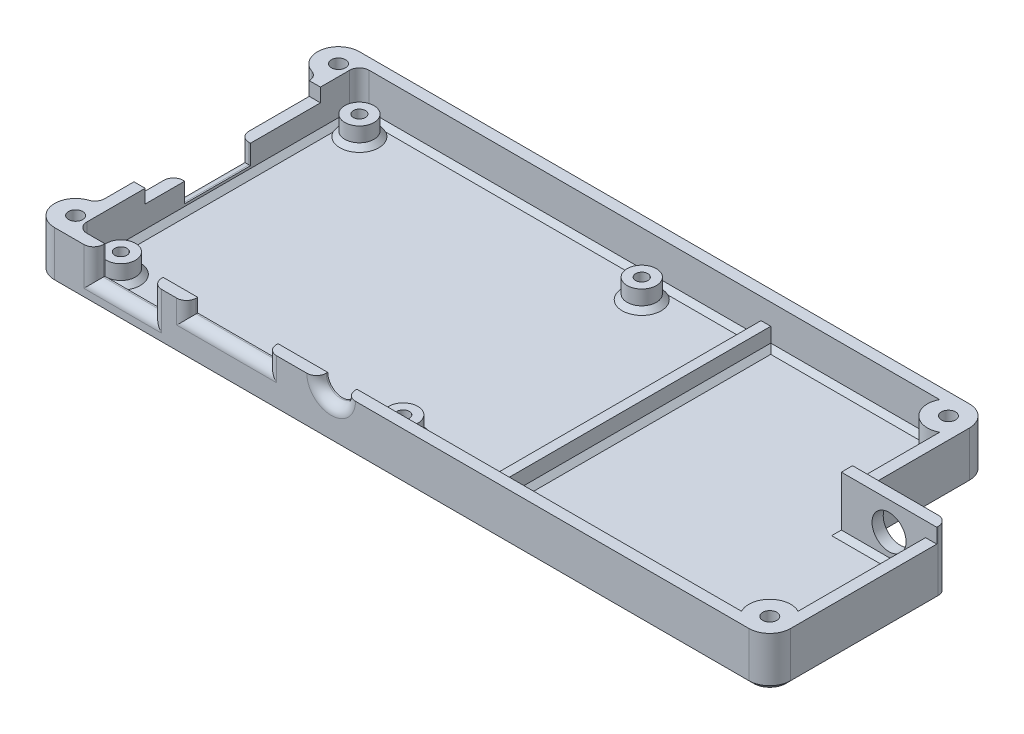
from build123d import *

# Parameters (mm, degrees)
BOSS_EXTRUDE1_DEPTH            = 10.3
BOSS_EXTRUDE2_DEPTH            = 2
SKETCH6_R                      = 3
BOSS_EXTRUDE3_DEPTH            = 4
F_2_5_2_5_DIAMETER_HOLE1_D     = 2.5
F_2_5_2_5_DIAMETER_HOLE1_DEPTH = 8
F_2_5_2_5_DIAMETER_HOLE1_TIP   = 0.751075774
SKETCH10_W                     = 2
SKETCH10_H                     = 58
BOSS_EXTRUDE4_DEPTH            = 4
CUT_EXTRUDE1_REACH             = 100.128
SKETCH11_R                     = 3
SKETCH11_W                     = 12
SKETCH11_H                     = 5.8
SKETCH11_W_2                   = 16.5
SKETCH11_H_2                   = 2.8
CUT_EXTRUDE2_REACH             = 153.227
SKETCH12_W                     = 13.5
SKETCH12_H                     = 6.8
SKETCH12_W_2                   = 36
SKETCH12_H_2                   = 2.8
FILLET6_R                      = 2
FILLET8_R                      = 2
CHAMFER1_SIZE                  = 1
FILLET9_R                      = 2
SKETCH14_W                     = 19.6
SKETCH14_H                     = 2.3
BOSS_EXTRUDE5_DEPTH            = 3
CUT_EXTRUDE3_REACH             = 86.384
SKETCH13_R                     = 3.5
BOSS_EXTRUDE6_DEPTH            = 10.3
F_2_9_2_9_DIAMETER_HOLE2_D     = 2.9
F_2_9_2_9_DIAMETER_HOLE1_D     = 2.9
BOSS_EXTRUDE7_REACH            = 89.052
SKETCH24_R                     = 4.3
F_2_9_2_9_DIAMETER_HOLE3_D     = 2.9
F_2_9_2_9_DIAMETER_HOLE4_D     = 2.9
FILLET10_R                     = 4.3
FILLET16_R                     = 4.3
FILLET17_R                     = 2
FILLET18_R                     = 2
CHAMFER3_SIZE                  = 1
FILLET19_R                     = 2


# Some blends are built 0.0001 mm under size
with BuildPart() as part:
    # Sketch3 → Boss-Extrude1 (new body)
    with BuildSketch(Plane(origin=(0, 0, 0), x_dir=(1, 0, 0), z_dir=(0, 1, 0))):
        Polygon((54.738233838, 8.405993834), (72.038233838, 8.405993834), (72.038233838, -28.194006166), (54.738233838, -28.194006166), (-74.861766162, -28.194006166), (-74.861766162, 34.405993834), (54.738233838, 34.405993834), align=None)
        Polygon((57.038233838, -25.894006166), (69.738233838, -25.894006166), (69.738233838, 6.105993834), (52.438233838, 6.105993834), (52.438233838, 32.105993834), (-72.561766162, 32.105993834), (-72.561766162, -25.894006166), (52.438233838, -25.894006166), align=None, mode=Mode.SUBTRACT)
    extrude(amount=BOSS_EXTRUDE1_DEPTH)

    # Sketch5 → Boss-Extrude2 (add)
    with BuildSketch(Plane(origin=(0, 0, 0), x_dir=(1, 0, 0), z_dir=(0, 1, 0))):
        Polygon((-72.561766162, 32.105993834), (52.438233838, 32.105993834), (52.438233838, 6.105993834), (69.738233838, 6.105993834), (69.738233838, -25.894006166), (50.438233838, -25.894006166), (-72.561766162, -25.894006166), align=None)
    extrude(amount=BOSS_EXTRUDE2_DEPTH)

    # Sketch6 → Boss-Extrude3 (add)
    with BuildSketch(Plane(origin=(0, 2, 0), x_dir=(1, 0, 0), z_dir=(0, 1, 0))):
        with Locations(Location((-68.061766162, 27.605993834, 0), (0, 0, 270))):
            Circle(SKETCH6_R)
        with Locations(Location((-68.061766162, -21.394006166, 0), (0, 0, 270))):
            Circle(SKETCH6_R)
        with Locations(Location((-10.061766162, -21.394006166, 0), (0, 0, 270))):
            Circle(SKETCH6_R)
        with Locations(Location((-10.061766162, 27.605993834, 0), (0, 0, 270))):
            Circle(SKETCH6_R)
    extrude(amount=BOSS_EXTRUDE3_DEPTH)

    # Ø2.5 (2.5) Diameter Hole1
    with Locations(Plane(origin=(0, 6, 0), x_dir=(1, 0, 0), z_dir=(0, 1, 0))):
        with Locations((-68.061766162, 27.605993834), (-10.061766162, 27.605993834), (-10.061766162, -21.394006166), (-68.061766162, -21.394006166)):
            Hole(F_2_5_2_5_DIAMETER_HOLE1_D / 2, depth=F_2_5_2_5_DIAMETER_HOLE1_DEPTH)
            with Locations((0, 0, -(F_2_5_2_5_DIAMETER_HOLE1_DEPTH + F_2_5_2_5_DIAMETER_HOLE1_TIP / 2))):  # 118° drill point
                Cone(0, F_2_5_2_5_DIAMETER_HOLE1_D / 2, F_2_5_2_5_DIAMETER_HOLE1_TIP, mode=Mode.SUBTRACT)

    # Sketch10 → Boss-Extrude4 (add)
    with BuildSketch(Plane(origin=(0, 2, 0), x_dir=(1, 0, 0), z_dir=(0, 1, 0))):
        with Locations((10.938233838, 3.105993834)):
            Rectangle(SKETCH10_W, SKETCH10_H)
    extrude(amount=BOSS_EXTRUDE4_DEPTH)

    # Sketch11 → Cut-Extrude1 (cut, up to next)
    with BuildSketch(Plane.XY.offset(28.194006166), mode=Mode.PRIVATE) as cut_extrude1_sk1:
        with Locations((-18.061766162, 10.3)):
            Circle(SKETCH11_R)
    cut_extrude1_tool1 = extrude(cut_extrude1_sk1.sketch, amount=-CUT_EXTRUDE1_REACH, mode=Mode.PRIVATE) & part.part
    # Sketch11 → Cut-Extrude1 (cut, up to next)
    with BuildSketch(Plane.XY.offset(28.194006166), mode=Mode.PRIVATE) as cut_extrude1_sk2:
        with Locations((-60.861766162, 7.4)):
            Rectangle(SKETCH11_W, SKETCH11_H)
    cut_extrude1_tool2 = extrude(cut_extrude1_sk2.sketch, amount=-CUT_EXTRUDE1_REACH, mode=Mode.PRIVATE) & part.part
    # Sketch11 → Cut-Extrude1 (cut, up to next)
    with BuildSketch(Plane.XY.offset(28.194006166), mode=Mode.PRIVATE) as cut_extrude1_sk3:
        with Locations((-39.527982648, 8.9)):
            Rectangle(SKETCH11_W_2, SKETCH11_H_2)
    cut_extrude1_tool3 = extrude(cut_extrude1_sk3.sketch, amount=-CUT_EXTRUDE1_REACH, mode=Mode.PRIVATE) & part.part
    add(cut_extrude1_tool1.solids().sort_by_distance((-18.061766, 10.3, 28.194006))[0], mode=Mode.SUBTRACT)
    add(cut_extrude1_tool2.solids().sort_by_distance((-60.861766, 7.4, 28.194006))[0], mode=Mode.SUBTRACT)
    add(cut_extrude1_tool3.solids().sort_by_distance((-39.527983, 8.9, 28.194006))[0], mode=Mode.SUBTRACT)

    # Sketch12 → Cut-Extrude2 (cut, up to next)
    with BuildSketch(Plane.ZY.offset(74.861766162), mode=Mode.PRIVATE) as cut_extrude2_sk1:
        with Locations((-2.982922372, 6.9)):
            Rectangle(SKETCH12_W, SKETCH12_H)
    cut_extrude2_tool1 = extrude(cut_extrude2_sk1.sketch, amount=-CUT_EXTRUDE2_REACH, mode=Mode.PRIVATE) & part.part
    # Sketch12 → Cut-Extrude2 (cut, up to next)
    with BuildSketch(Plane.ZY.offset(74.861766162), mode=Mode.PRIVATE) as cut_extrude2_sk2:
        with Locations((-6.105993834, 8.9)):
            Rectangle(SKETCH12_W_2, SKETCH12_H_2)
    cut_extrude2_tool2 = extrude(cut_extrude2_sk2.sketch, amount=-CUT_EXTRUDE2_REACH, mode=Mode.PRIVATE) & part.part
    add(cut_extrude2_tool1.solids().sort_by_distance((-74.861766, 6.9, -2.982922))[0], mode=Mode.SUBTRACT)
    add(cut_extrude2_tool2.solids().sort_by_distance((-74.861766, 8.9, -6.105994))[0], mode=Mode.SUBTRACT)

    # Fillet6
    fillet6_edges = [part.edges().sort_by_distance(p)[0] for p in [
        (52.438233838, 6.15, -32.105993834),
    ]]
    fillet(fillet6_edges, radius=FILLET6_R)

    # Fillet8
    fillet8_edges = [part.edges().sort_by_distance(p)[0] for p in [
        (-72.561766162, 6.15, -32.105993834),
        (-72.561766162, 6.15, 25.894006166),
    ]]
    fillet(fillet8_edges, radius=FILLET8_R)

    # Chamfer1
    chamfer1_edges = [part.edges().sort_by_distance(p)[0] for p in [
        (-68.061766162, 2, -30.605993834),
        (-68.061766162, 2, 18.394006166),
        (-10.061766162, 2, 18.394006166),
        (-10.061766162, 2, -30.605993834),
    ]]
    chamfer(chamfer1_edges, length=CHAMFER1_SIZE)

    # Chamfer2
    # the kernel refuses this chamfer: 1 mm, written as the material it adds along each edge
    with BuildSketch(Plane(origin=(69.738233838, 2, 25.894006166), x_dir=(0, 0.9996219169112968, 0.027495876610585623), z_dir=(-1, 0, 0))) as chamfer2_piece_1:
        with BuildLine():
            Line((1.028673195, 0), (-0.056547155, 1.027117794))
            Line((-0.056547155, 1.027117794), (-0.076539593, 1.026567876))
            ThreePointArc((-0.076539593, 1.026567876), (-0.034129227, 0.51339783), (-0.019992438, -0.000549918))
            Line((-0.019992438, -0.000549918), (0.000549918, -0.019992438))
            ThreePointArc((0.000549918, -0.019992438), (0.514497665, -0.00585565), (1.029223113, -0.019992438))
            Line((1.029223113, -0.019992438), (1.028673195, 0))
        make_face()
    extrude(amount=57.8)
    with BuildSketch(Plane(origin=(-70.561766162, 2, -32.105993834), x_dir=(0, -0.027495876610586296, 0.9996219169112968), z_dir=(1, 0, 0)), Plane(origin=(9.938233838, 2, 25.894006166), x_dir=(0, -0.027495876610586726, -0.9996219169112968), z_dir=(-1, 0, 0))) as chamfer2_piece_2:
        with BuildLine():
            Line((1.028673195, 0), (-0.056547155, -1.027117794))
            Line((-0.056547155, -1.027117794), (-0.076539593, -1.026567876))
            ThreePointArc((-0.076539593, -1.026567876), (-0.034129227, -0.51339783), (-0.019992438, 0.000549918))
            Line((-0.019992438, 0.000549918), (0.000549918, 0.019992438))
            ThreePointArc((0.000549918, 0.019992438), (0.514497665, 0.00585565), (1.029223113, 0.019992438))
            Line((1.029223113, 0.019992438), (1.028673195, 0))
        make_face()
    extrude(amount=80.5)
    with BuildSketch(Plane(origin=(9.938233838, 2, 25.894006166), x_dir=(-0.9996219169112968, -0.027495876610586247, 0), z_dir=(0, 0, -1))) as chamfer2_piece_3:
        with BuildLine():
            Line((1.028673195, 0), (-0.056547155, 1.027117794))
            Line((-0.056547155, 1.027117794), (-0.076539593, 1.026567876))
            ThreePointArc((-0.076539593, 1.026567876), (-0.034129227, 0.51339783), (-0.019992438, -0.000549918))
            Line((-0.019992438, -0.000549918), (0.000549918, -0.019992438))
            ThreePointArc((0.000549918, -0.019992438), (0.514497665, -0.00585565), (1.029223113, -0.019992438))
            Line((1.029223113, -0.019992438), (1.028673195, 0))
        make_face()
    extrude(amount=58)
    with BuildSketch(Plane(origin=(11.938233838, 2, -32.105993834), x_dir=(-0.027495876610585623, 0.9996219169112968, 0), z_dir=(0, 0, 1))) as chamfer2_piece_4:
        with BuildLine():
            Line((1.028673195, 0), (-0.056547155, -1.027117794))
            Line((-0.056547155, -1.027117794), (-0.076539593, -1.026567876))
            ThreePointArc((-0.076539593, -1.026567876), (-0.034129227, -0.51339783), (-0.019992438, 0.000549918))
            Line((-0.019992438, 0.000549918), (0.000549918, 0.019992438))
            ThreePointArc((0.000549918, 0.019992438), (0.514497665, 0.00585565), (1.029223113, 0.019992438))
            Line((1.029223113, 0.019992438), (1.028673195, 0))
        make_face()
    extrude(amount=58)
    with BuildSketch(Plane(origin=(11.938233838, 2, -32.105993834), x_dir=(0, 0.9996219169112968, -0.027495876610589075), z_dir=(1, 0, 0))) as chamfer2_piece_5:
        with BuildLine():
            Line((1.028673195, 0), (-0.056547155, 1.027117794))
            Line((-0.056547155, 1.027117794), (-0.076539593, 1.026567876))
            ThreePointArc((-0.076539593, 1.026567876), (-0.034129227, 0.51339783), (-0.019992438, -0.000549918))
            Line((-0.019992438, -0.000549918), (0.000549918, -0.019992438))
            ThreePointArc((0.000549918, -0.019992438), (0.514497665, -0.00585565), (1.029223113, -0.019992438))
            Line((1.029223113, -0.019992438), (1.028673195, 0))
        make_face()
    extrude(amount=38.5)
    with BuildSketch(Plane(origin=(50.438233838, 2, -30.105993834), x_dir=(0, 0, -1), z_dir=(-1, 0, 0))) as chamfer2_piece_6:
        with BuildLine():
            Line((0.971715729, 0.028284271), (2.028284271, -1.028284271))
            Line((2.028284271, -1.028284271), (2.048284271, -1.028284271))
            ThreePointArc((2.048284271, -1.028284271), (2.02, -0.514142136), (2.02, 0))
            Line((2.02, 0), (2, 0.02))
            ThreePointArc((2, 0.02), (1.485857864, 0.02), (0.971715729, 0.048284271))
            Line((0.971715729, 0.048284271), (0.971715729, 0.028284271))
        make_face()
    revolve(axis=Axis((50.438233838, 2, -30.105993834), (0, -1, 0)), revolution_arc=90)
    with BuildSketch(Plane(origin=(-72.561766162, 2, 23.894006166), x_dir=(0.9996219169112968, -0.027495876610586605, 0), z_dir=(0, 0, -1))) as chamfer2_piece_7:
        with BuildLine():
            Line((1.028673195, 0), (-0.056547155, -1.027117794))
            Line((-0.056547155, -1.027117794), (-0.076539593, -1.026567876))
            ThreePointArc((-0.076539593, -1.026567876), (-0.034129227, -0.51339783), (-0.019992438, 0.000549918))
            Line((-0.019992438, 0.000549918), (0.000549918, 0.019992438))
            ThreePointArc((0.000549918, 0.019992438), (0.514497665, 0.00585565), (1.029223113, 0.019992438))
            Line((1.029223113, 0.019992438), (1.028673195, 0))
        make_face()
    extrude(amount=54)
    with BuildSketch(Plane(origin=(-70.561766162, 2, -30.105993834), x_dir=(0, 0, -1), z_dir=(1, 0, 0))) as chamfer2_piece_8:
        with BuildLine():
            Line((0.971715729, -0.028284271), (2.028284271, 1.028284271))
            Line((2.028284271, 1.028284271), (2.048284271, 1.028284271))
            ThreePointArc((2.048284271, 1.028284271), (2.02, 0.514142136), (2.02, 0))
            Line((2.02, 0), (2, -0.02))
            ThreePointArc((2, -0.02), (1.485857864, -0.02), (0.971715729, -0.048284271))
            Line((0.971715729, -0.048284271), (0.971715729, -0.028284271))
        make_face()
    revolve(axis=Axis((-70.561766162, 2, -30.105993834), (0, 1, 0)), revolution_arc=90)
    with BuildSketch(Plane(origin=(-70.561766162, 2, 23.894006166), x_dir=(-1, 0, 0), z_dir=(0, 0, -1))) as chamfer2_piece_9:
        with BuildLine():
            Line((0.971715729, -0.028284271), (2.028284271, 1.028284271))
            Line((2.028284271, 1.028284271), (2.048284271, 1.028284271))
            ThreePointArc((2.048284271, 1.028284271), (2.02, 0.514142136), (2.02, 0))
            Line((2.02, 0), (2, -0.02))
            ThreePointArc((2, -0.02), (1.485857864, -0.02), (0.971715729, -0.048284271))
            Line((0.971715729, -0.048284271), (0.971715729, -0.028284271))
        make_face()
    revolve(axis=Axis((-70.561766162, 2, 23.894006166), (0, 1, 0)), revolution_arc=90)
    with BuildSketch(Plane(origin=(69.738233838, 2, -6.105993834), x_dir=(-0.9996219169112968, -0.02749587661058639, 0), z_dir=(0, 0, 1))) as chamfer2_piece_10:
        with BuildLine():
            Line((1.028673195, 0), (-0.056547155, -1.027117794))
            Line((-0.056547155, -1.027117794), (-0.076539593, -1.026567876))
            ThreePointArc((-0.076539593, -1.026567876), (-0.034129227, -0.51339783), (-0.019992438, 0.000549918))
            Line((-0.019992438, 0.000549918), (0.000549918, 0.019992438))
            ThreePointArc((0.000549918, 0.019992438), (0.514497665, 0.00585565), (1.029223113, 0.019992438))
            Line((1.029223113, 0.019992438), (1.028673195, 0))
        make_face()
    extrude(amount=32)
    with BuildSketch(Plane(origin=(52.438233838, 2, -6.105993834), x_dir=(0, -0.02749587661058627, 0.9996219169112968), z_dir=(1, 0, 0))) as chamfer2_piece_11:
        with BuildLine():
            Line((1.028673195, 0), (-0.056547155, -1.027117794))
            Line((-0.056547155, -1.027117794), (-0.076539593, -1.026567876))
            ThreePointArc((-0.076539593, -1.026567876), (-0.034129227, -0.51339783), (-0.019992438, 0.000549918))
            Line((-0.019992438, 0.000549918), (0.000549918, 0.019992438))
            ThreePointArc((0.000549918, 0.019992438), (0.514497665, 0.00585565), (1.029223113, 0.019992438))
            Line((1.029223113, 0.019992438), (1.028673195, 0))
        make_face()
    extrude(amount=17.3)
    with BuildSketch(Plane(origin=(52.438233838, 2, -30.105993834), x_dir=(-0.9996219169112968, -0.0274958766105862, 0), z_dir=(0, 0, 1))) as chamfer2_piece_12:
        with BuildLine():
            Line((1.028673195, 0), (-0.056547155, -1.027117794))
            Line((-0.056547155, -1.027117794), (-0.076539593, -1.026567876))
            ThreePointArc((-0.076539593, -1.026567876), (-0.034129227, -0.51339783), (-0.019992438, 0.000549918))
            Line((-0.019992438, 0.000549918), (0.000549918, 0.019992438))
            ThreePointArc((0.000549918, 0.019992438), (0.514497665, 0.00585565), (1.029223113, 0.019992438))
            Line((1.029223113, 0.019992438), (1.028673195, 0))
        make_face()
    extrude(amount=24)
    with BuildSketch(Plane(origin=(72.309916826, 2, 25.894006166), x_dir=(0, 0.9996219169112968, 0.027495876610585623), z_dir=(-1, 0, 0))) as chamfer2_piece_13a_section:
        with BuildLine():
            Line((1.028673195, 0), (-0.056547155, 1.027117794))
            Line((-0.056547155, 1.027117794), (-0.076539593, 1.026567876))
            ThreePointArc((-0.076539593, 1.026567876), (-0.034129227, 0.51339783), (-0.019992438, -0.000549918))
            Line((-0.019992438, -0.000549918), (0.000549918, -0.019992438))
            ThreePointArc((0.000549918, -0.019992438), (0.514497665, -0.00585565), (1.029223113, -0.019992438))
            Line((1.029223113, -0.019992438), (1.028673195, 0))
        make_face()
    chamfer2_piece_13a = extrude(amount=60.371682988, mode=Mode.PRIVATE)
    chamfer2_piece_13a = split(chamfer2_piece_13a, bisect_by=Plane(origin=(69.738233838, 2.329793627, 25.564212539), z_dir=(1, 0, 0)), keep=Keep.TOP, mode=Mode.PRIVATE)
    with BuildSketch(Plane(origin=(69.738233838, 2, -6.105993834), x_dir=(-0.9996219169112968, -0.02749587661058639, 0), z_dir=(0, 0, 1))) as chamfer2_piece_13b_section:
        with BuildLine():
            Line((1.028673195, 0), (-0.056547155, -1.027117794))
            Line((-0.056547155, -1.027117794), (-0.076539593, -1.026567876))
            ThreePointArc((-0.076539593, -1.026567876), (-0.034129227, -0.51339783), (-0.019992438, 0.000549918))
            Line((-0.019992438, 0.000549918), (0.000549918, 0.019992438))
            ThreePointArc((0.000549918, 0.019992438), (0.514497665, 0.00585565), (1.029223113, 0.019992438))
            Line((1.029223113, 0.019992438), (1.028673195, 0))
        make_face()
    chamfer2_piece_13b = extrude(amount=34.571682988, mode=Mode.PRIVATE)
    chamfer2_piece_13b = split(chamfer2_piece_13b, bisect_by=Plane(origin=(69.408440211, 2.329793627, 25.894006166), z_dir=(0, 0, 1)), keep=Keep.TOP, mode=Mode.PRIVATE)
    chamfer2_piece_13 = chamfer2_piece_13a & chamfer2_piece_13b
    add(chamfer2_piece_13)
    with BuildSketch(Plane(origin=(69.738233838, 2, 25.894006166), x_dir=(0, 0.9996219169112968, 0.027495876610585623), z_dir=(-1, 0, 0))) as chamfer2_piece_14a_section:
        with BuildLine():
            Line((1.028673195, 0), (-0.056547155, 1.027117794))
            Line((-0.056547155, 1.027117794), (-0.076539593, 1.026567876))
            ThreePointArc((-0.076539593, 1.026567876), (-0.034129227, 0.51339783), (-0.019992438, -0.000549918))
            Line((-0.019992438, -0.000549918), (0.000549918, -0.019992438))
            ThreePointArc((0.000549918, -0.019992438), (0.514497665, -0.00585565), (1.029223113, -0.019992438))
            Line((1.029223113, -0.019992438), (1.028673195, 0))
        make_face()
    chamfer2_piece_14a = extrude(amount=60.371682988, mode=Mode.PRIVATE)
    chamfer2_piece_14a = split(chamfer2_piece_14a, bisect_by=Plane(origin=(11.938233838, 2.329793627, 25.564212539), z_dir=(-1, 0, 0)), keep=Keep.TOP, mode=Mode.PRIVATE)
    with BuildSketch(Plane(origin=(11.938233838, 2, -32.105993834), x_dir=(-0.027495876610585623, 0.9996219169112968, 0), z_dir=(0, 0, 1))) as chamfer2_piece_14b_section:
        with BuildLine():
            Line((1.028673195, 0), (-0.056547155, -1.027117794))
            Line((-0.056547155, -1.027117794), (-0.076539593, -1.026567876))
            ThreePointArc((-0.076539593, -1.026567876), (-0.034129227, -0.51339783), (-0.019992438, 0.000549918))
            Line((-0.019992438, 0.000549918), (0.000549918, 0.019992438))
            ThreePointArc((0.000549918, 0.019992438), (0.514497665, 0.00585565), (1.029223113, 0.019992438))
            Line((1.029223113, 0.019992438), (1.028673195, 0))
        make_face()
    chamfer2_piece_14b = extrude(amount=60.571682988, mode=Mode.PRIVATE)
    chamfer2_piece_14b = split(chamfer2_piece_14b, bisect_by=Plane(origin=(12.268027465, 2.329793627, 25.894006166), z_dir=(0, 0, 1)), keep=Keep.TOP, mode=Mode.PRIVATE)
    chamfer2_piece_14 = chamfer2_piece_14a & chamfer2_piece_14b
    add(chamfer2_piece_14)
    with BuildSketch(Plane(origin=(-70.561766162, 2, -32.105993834), x_dir=(0, -0.027495876610586296, 0.9996219169112968), z_dir=(1, 0, 0))) as chamfer2_piece_15a_section:
        with BuildLine():
            Line((1.028673195, 0), (-0.056547155, -1.027117794))
            Line((-0.056547155, -1.027117794), (-0.076539593, -1.026567876))
            ThreePointArc((-0.076539593, -1.026567876), (-0.034129227, -0.51339783), (-0.019992438, 0.000549918))
            Line((-0.019992438, 0.000549918), (0.000549918, 0.019992438))
            ThreePointArc((0.000549918, 0.019992438), (0.514497665, 0.00585565), (1.029223113, 0.019992438))
            Line((1.029223113, 0.019992438), (1.028673195, 0))
        make_face()
    chamfer2_piece_15a = extrude(amount=83.071682988, mode=Mode.PRIVATE)
    chamfer2_piece_15a = split(chamfer2_piece_15a, bisect_by=Plane(origin=(9.938233838, 2.329793627, -31.776200208), z_dir=(1, 0, 0)), keep=Keep.TOP, mode=Mode.PRIVATE)
    with BuildSketch(Plane(origin=(9.938233838, 2, 25.894006166), x_dir=(-0.9996219169112968, -0.027495876610586247, 0), z_dir=(0, 0, -1))) as chamfer2_piece_15b_section:
        with BuildLine():
            Line((1.028673195, 0), (-0.056547155, 1.027117794))
            Line((-0.056547155, 1.027117794), (-0.076539593, 1.026567876))
            ThreePointArc((-0.076539593, 1.026567876), (-0.034129227, 0.51339783), (-0.019992438, -0.000549918))
            Line((-0.019992438, -0.000549918), (0.000549918, -0.019992438))
            ThreePointArc((0.000549918, -0.019992438), (0.514497665, -0.00585565), (1.029223113, -0.019992438))
            Line((1.029223113, -0.019992438), (1.028673195, 0))
        make_face()
    chamfer2_piece_15b = extrude(amount=60.571682988, mode=Mode.PRIVATE)
    chamfer2_piece_15b = split(chamfer2_piece_15b, bisect_by=Plane(origin=(9.608440211, 2.329793627, -32.105993834), z_dir=(0, 0, -1)), keep=Keep.TOP, mode=Mode.PRIVATE)
    chamfer2_piece_15 = chamfer2_piece_15a & chamfer2_piece_15b
    add(chamfer2_piece_15)
    with BuildSketch(Plane(origin=(12.509916826, 2, 25.894006166), x_dir=(0, -0.027495876610586296, -0.9996219169112968), z_dir=(-1, 0, 0))) as chamfer2_piece_16a_section:
        with BuildLine():
            Line((1.028673195, 0), (-0.056547155, -1.027117794))
            Line((-0.056547155, -1.027117794), (-0.076539593, -1.026567876))
            ThreePointArc((-0.076539593, -1.026567876), (-0.034129227, -0.51339783), (-0.019992438, 0.000549918))
            Line((-0.019992438, 0.000549918), (0.000549918, 0.019992438))
            ThreePointArc((0.000549918, 0.019992438), (0.514497665, 0.00585565), (1.029223113, 0.019992438))
            Line((1.029223113, 0.019992438), (1.028673195, 0))
        make_face()
    chamfer2_piece_16a = extrude(amount=83.071682988, mode=Mode.PRIVATE)
    chamfer2_piece_16a = split(chamfer2_piece_16a, bisect_by=Plane(origin=(9.938233838, 2.329793627, 25.564212539), z_dir=(1, 0, 0)), keep=Keep.TOP, mode=Mode.PRIVATE)
    with BuildSketch(Plane(origin=(9.938233838, 2, 28.465689154), x_dir=(-0.9996219169112968, -0.027495876610586296, 0), z_dir=(0, 0, -1))) as chamfer2_piece_16b_section:
        with BuildLine():
            Line((1.028673195, 0), (-0.056547155, 1.027117794))
            Line((-0.056547155, 1.027117794), (-0.076539593, 1.026567876))
            ThreePointArc((-0.076539593, 1.026567876), (-0.034129227, 0.51339783), (-0.019992438, -0.000549918))
            Line((-0.019992438, -0.000549918), (0.000549918, -0.019992438))
            ThreePointArc((0.000549918, -0.019992438), (0.514497665, -0.00585565), (1.029223113, -0.019992438))
            Line((1.029223113, -0.019992438), (1.028673195, 0))
        make_face()
    chamfer2_piece_16b = extrude(amount=60.571682988, mode=Mode.PRIVATE)
    chamfer2_piece_16b = split(chamfer2_piece_16b, bisect_by=Plane(origin=(9.608440211, 2.329793627, 25.894006166), z_dir=(0, 0, 1)), keep=Keep.TOP, mode=Mode.PRIVATE)
    chamfer2_piece_16 = chamfer2_piece_16a & chamfer2_piece_16b
    add(chamfer2_piece_16)
    with BuildSketch(Plane(origin=(9.36655085, 2, -32.105993834), x_dir=(0, 0.9996219169112968, -0.027495876610589075), z_dir=(1, 0, 0))) as chamfer2_piece_17a_section:
        with BuildLine():
            Line((1.028673195, 0), (-0.056547155, 1.027117794))
            Line((-0.056547155, 1.027117794), (-0.076539593, 1.026567876))
            ThreePointArc((-0.076539593, 1.026567876), (-0.034129227, 0.51339783), (-0.019992438, -0.000549918))
            Line((-0.019992438, -0.000549918), (0.000549918, -0.019992438))
            ThreePointArc((0.000549918, -0.019992438), (0.514497665, -0.00585565), (1.029223113, -0.019992438))
            Line((1.029223113, -0.019992438), (1.028673195, 0))
        make_face()
    chamfer2_piece_17a = extrude(amount=41.071682988, mode=Mode.PRIVATE)
    chamfer2_piece_17a = split(chamfer2_piece_17a, bisect_by=Plane(origin=(11.938233838, 2.329793627, -31.776200208), z_dir=(-1, 0, 0)), keep=Keep.TOP, mode=Mode.PRIVATE)
    with BuildSketch(Plane(origin=(11.938233838, 2, -34.677676822), x_dir=(-0.027495876610585623, 0.9996219169112968, 0), z_dir=(0, 0, 1))) as chamfer2_piece_17b_section:
        with BuildLine():
            Line((1.028673195, 0), (-0.056547155, -1.027117794))
            Line((-0.056547155, -1.027117794), (-0.076539593, -1.026567876))
            ThreePointArc((-0.076539593, -1.026567876), (-0.034129227, -0.51339783), (-0.019992438, 0.000549918))
            Line((-0.019992438, 0.000549918), (0.000549918, 0.019992438))
            ThreePointArc((0.000549918, 0.019992438), (0.514497665, 0.00585565), (1.029223113, 0.019992438))
            Line((1.029223113, 0.019992438), (1.028673195, 0))
        make_face()
    chamfer2_piece_17b = extrude(amount=60.571682988, mode=Mode.PRIVATE)
    chamfer2_piece_17b = split(chamfer2_piece_17b, bisect_by=Plane(origin=(12.268027465, 2.329793627, -32.105993834), z_dir=(0, 0, -1)), keep=Keep.TOP, mode=Mode.PRIVATE)
    chamfer2_piece_17 = chamfer2_piece_17a & chamfer2_piece_17b
    add(chamfer2_piece_17)
    with BuildSketch(Plane(origin=(52.438233838, 2, -6.105993834), x_dir=(0, -0.02749587661058627, 0.9996219169112968), z_dir=(1, 0, 0))) as chamfer2_piece_18a_section:
        with BuildLine():
            Line((1.028673195, 0), (-0.056547155, -1.027117794))
            Line((-0.056547155, -1.027117794), (-0.076539593, -1.026567876))
            ThreePointArc((-0.076539593, -1.026567876), (-0.034129227, -0.51339783), (-0.019992438, 0.000549918))
            Line((-0.019992438, 0.000549918), (0.000549918, 0.019992438))
            ThreePointArc((0.000549918, 0.019992438), (0.514497665, 0.00585565), (1.029223113, 0.019992438))
            Line((1.029223113, 0.019992438), (1.028673195, 0))
        make_face()
    chamfer2_piece_18a = extrude(amount=19.871682988, mode=Mode.PRIVATE)
    chamfer2_piece_18a = split(chamfer2_piece_18a, bisect_by=Plane(origin=(69.738233838, 2.329793627, -5.776200208), z_dir=(1, 0, 0)), keep=Keep.TOP, mode=Mode.PRIVATE)
    with BuildSketch(Plane(origin=(69.738233838, 2, -8.677676822), x_dir=(-0.9996219169112968, -0.02749587661058639, 0), z_dir=(0, 0, 1))) as chamfer2_piece_18b_section:
        with BuildLine():
            Line((1.028673195, 0), (-0.056547155, -1.027117794))
            Line((-0.056547155, -1.027117794), (-0.076539593, -1.026567876))
            ThreePointArc((-0.076539593, -1.026567876), (-0.034129227, -0.51339783), (-0.019992438, 0.000549918))
            Line((-0.019992438, 0.000549918), (0.000549918, 0.019992438))
            ThreePointArc((0.000549918, 0.019992438), (0.514497665, 0.00585565), (1.029223113, 0.019992438))
            Line((1.029223113, 0.019992438), (1.028673195, 0))
        make_face()
    chamfer2_piece_18b = extrude(amount=34.571682988, mode=Mode.PRIVATE)
    chamfer2_piece_18b = split(chamfer2_piece_18b, bisect_by=Plane(origin=(69.408440211, 2.329793627, -6.105993834), z_dir=(0, 0, -1)), keep=Keep.TOP, mode=Mode.PRIVATE)
    chamfer2_piece_18 = chamfer2_piece_18a & chamfer2_piece_18b
    add(chamfer2_piece_18)
    with BuildSketch(Plane(origin=(52.438233838, 2, -30.105993834), x_dir=(-0.9996219169112968, -0.0274958766105862, 0), z_dir=(0, 0, 1))) as chamfer2_piece_19a_section:
        with BuildLine():
            Line((1.028673195, 0), (-0.056547155, -1.027117794))
            Line((-0.056547155, -1.027117794), (-0.076539593, -1.026567876))
            ThreePointArc((-0.076539593, -1.026567876), (-0.034129227, -0.51339783), (-0.019992438, 0.000549918))
            Line((-0.019992438, 0.000549918), (0.000549918, 0.019992438))
            ThreePointArc((0.000549918, 0.019992438), (0.514497665, 0.00585565), (1.029223113, 0.019992438))
            Line((1.029223113, 0.019992438), (1.028673195, 0))
        make_face()
    chamfer2_piece_19a = extrude(amount=26.571682988, mode=Mode.PRIVATE)
    chamfer2_piece_19a = split(chamfer2_piece_19a, bisect_by=Plane(origin=(52.108440211, 2.329793627, -6.105993834), z_dir=(0, 0, 1)), keep=Keep.TOP, mode=Mode.PRIVATE)
    with BuildSketch(Plane(origin=(49.86655085, 2, -6.105993834), x_dir=(0, -0.02749587661058627, 0.9996219169112968), z_dir=(1, 0, 0))) as chamfer2_piece_19b_section:
        with BuildLine():
            Line((1.028673195, 0), (-0.056547155, -1.027117794))
            Line((-0.056547155, -1.027117794), (-0.076539593, -1.026567876))
            ThreePointArc((-0.076539593, -1.026567876), (-0.034129227, -0.51339783), (-0.019992438, 0.000549918))
            Line((-0.019992438, 0.000549918), (0.000549918, 0.019992438))
            ThreePointArc((0.000549918, 0.019992438), (0.514497665, 0.00585565), (1.029223113, 0.019992438))
            Line((1.029223113, 0.019992438), (1.028673195, 0))
        make_face()
    chamfer2_piece_19b = extrude(amount=19.871682988, mode=Mode.PRIVATE)
    chamfer2_piece_19b = split(chamfer2_piece_19b, bisect_by=Plane(origin=(52.438233838, 2.329793627, -5.776200208), z_dir=(-1, 0, 0)), keep=Keep.TOP, mode=Mode.PRIVATE)
    chamfer2_piece_19 = chamfer2_piece_19a & chamfer2_piece_19b
    add(chamfer2_piece_19)

    # Fillet9
    fillet9_edges = [part.edges().sort_by_distance(p)[0] for p in [
        (-60.861766162, 4.5, 28.194006166),
        (-54.861766162, 7.4, 28.194006166),
        (-47.777982648, 8.9, 28.194006166),
        (-39.527982648, 7.5, 28.194006166),
        (-31.277982648, 8.9, 28.194006166),
        (-18.061766162, 7.3, 28.194006166),
        (-74.861766162, 5.5, -9.732922372),
        (-74.861766162, 3.5, -2.982922372),
        (-74.861766162, 5.5, 3.767077628),
    ]]
    fillet(fillet9_edges, radius=FILLET9_R)

    # Sketch14 → Boss-Extrude5 (add)
    with BuildSketch(Plane(origin=(0, 10.3, 0), x_dir=(1, 0, 0), z_dir=(0, 1, 0))):
        with Locations((62.238233838, 7.255993834)):
            Rectangle(SKETCH14_W, SKETCH14_H)
    extrude(amount=BOSS_EXTRUDE5_DEPTH)

    # Sketch13 → Cut-Extrude3 (cut, up to next)
    with BuildSketch(Plane(origin=(0, 0, -8.405993834), x_dir=(-1, 0, 0), z_dir=(0, 0, -1)), mode=Mode.PRIVATE) as cut_extrude3_sk1:
        with Locations((-62.238233838, 7.5442849)):
            Circle(SKETCH13_R)
    cut_extrude3_tool1 = extrude(cut_extrude3_sk1.sketch, amount=-CUT_EXTRUDE3_REACH, mode=Mode.PRIVATE) & part.part
    add(cut_extrude3_tool1.solids().sort_by_distance((62.238234, 7.544285, -8.405994))[0], mode=Mode.SUBTRACT)

    # Sketch17 → Boss-Extrude6 (add)
    with BuildSketch(Plane(origin=(0, 0, 0), x_dir=(1, 0, 0), z_dir=(0, 1, 0))):
        with BuildLine():
            Line((-74.861766162, 34.405993834), (-74.861766162, 25.805993834))
            ThreePointArc((-74.861766162, 25.805993834), (-79.161766162, 30.105993834), (-74.861766162, 34.405993834))
        make_face()
        with BuildLine():
            Line((-74.861766162, -19.594006166), (-74.861766162, -28.194006166))
            ThreePointArc((-74.861766162, -28.194006166), (-79.161766162, -23.894006166), (-74.861766162, -19.594006166))
        make_face()
    extrude(amount=BOSS_EXTRUDE6_DEPTH)

    # Ø2.9 (2.9) Diameter Hole2 (through all)
    with Locations(Plane(origin=(0, 10.3, 0), x_dir=(1, 0, 0), z_dir=(0, 1, 0))):
        with Locations((-74.861766162, 30.105993834)):
            Hole(F_2_9_2_9_DIAMETER_HOLE2_D / 2)

    # Ø2.9 (2.9) Diameter Hole1 (through all)
    with Locations(Plane(origin=(0, 10.3, 0), x_dir=(1, 0, 0), z_dir=(0, 1, 0))):
        with Locations((-74.861766162, -23.894006166)):
            Hole(F_2_9_2_9_DIAMETER_HOLE1_D / 2)

    # Boss-Extrude7: up to this face of the body (flat: up to its plane)
    boss_extrude7_end = Plane(part.part.faces().sort_by_distance((53.588233838, 10.3, -9.770002999))[0])
    # Sketch24 → Boss-Extrude7 (add, up to the picked face)
    with BuildSketch(Plane(origin=(0, 2, 0), x_dir=(1, 0, 0), z_dir=(0, 1, 0)), mode=Mode.PRIVATE) as boss_extrude7_sk1:
        with Locations((67.738233838, -23.894006166)):
            Circle(SKETCH24_R)
    boss_extrude7_tool1 = split(extrude(boss_extrude7_sk1.sketch, amount=BOSS_EXTRUDE7_REACH, mode=Mode.PRIVATE), bisect_by=boss_extrude7_end, keep=Keep.BOTH, mode=Mode.PRIVATE)
    # Sketch24 → Boss-Extrude7 (add, up to the picked face)
    with BuildSketch(Plane(origin=(0, 2, 0), x_dir=(1, 0, 0), z_dir=(0, 1, 0)), mode=Mode.PRIVATE) as boss_extrude7_sk2:
        with Locations((50.438233838, 30.105993834)):
            Circle(SKETCH24_R)
    boss_extrude7_tool2 = split(extrude(boss_extrude7_sk2.sketch, amount=BOSS_EXTRUDE7_REACH, mode=Mode.PRIVATE), bisect_by=boss_extrude7_end, keep=Keep.BOTH, mode=Mode.PRIVATE)
    add(boss_extrude7_tool1.solids().sort_by(Axis((67.738234, 2, 23.894006), (0, 1, 0)))[0])
    add(boss_extrude7_tool2.solids().sort_by(Axis((50.438234, 2, -30.105994), (0, 1, 0)))[0])

    # Ø2.9 (2.9) Diameter Hole3 (through all)
    with Locations(Plane(origin=(0, 10.3, 0), x_dir=(1, 0, 0), z_dir=(0, 1, 0))):
        with Locations((67.738233838, -23.894006166)):
            Hole(F_2_9_2_9_DIAMETER_HOLE3_D / 2)

    # Ø2.9 (2.9) Diameter Hole4 (through all)
    with Locations(Plane(origin=(0, 10.3, 0), x_dir=(1, 0, 0), z_dir=(0, 1, 0))):
        with Locations((50.438233838, 30.105993834)):
            Hole(F_2_9_2_9_DIAMETER_HOLE4_D / 2)

    # Fillet10
    fillet10_edges = [part.edges().sort_by_distance(p)[0] for p in [
        (54.738233838, 5.15, -34.405993834),
    ]]
    fillet(fillet10_edges, radius=FILLET10_R - 0.0001)  # a hair under: the kernel refuses the full size

    # Fillet16
    fillet16_edges = [part.edges().sort_by_distance(p)[0] for p in [
        (72.038233838, 5.15, 28.194006166),
    ]]
    fillet(fillet16_edges, radius=FILLET16_R - 0.0001)  # a hair under: the kernel refuses the full size

    # Fillet17
    fillet17_edges = [part.edges().sort_by_distance(p)[0] for p in [
        (54.738233838, 5.15, -8.405993834),
        (72.038233838, 6.65, -8.405993834),
    ]]
    fillet(fillet17_edges, radius=FILLET17_R)

    # Fillet18
    fillet18_edges = [part.edges().sort_by_distance(p)[0] for p in [
        (-74.861766162, 5.15, -25.805993834),
        (-74.861766162, 5.15, 19.594006166),
    ]]
    fillet(fillet18_edges, radius=FILLET18_R)

    # Chamfer3
    chamfer3_edges = [part.edges().sort_by_distance(p)[0] for p in [
        (-79.105793795, 0, -30.797535193),
        (-12.211716162, 0, -34.405993834),
        (53.478822286, 0, -33.146582283),
        (72.038233838, 0, 8.744056166),
        (70.778822286, 0, 26.934594614),
        (54.738233838, 0, -20.256043834),
        (63.388233838, 0, -8.405993834),
        (71.4524474, 0, -7.820207397),
        (55.324020275, 0, -8.991780272),
        (-79.105793795, 0, 24.585547524),
        (-74.861766162, 0, -3.105993834),
        (-75.2385223, 0, 19.088261462),
        (-75.2385223, 0, -25.300249131),
        (-3.561716162, 0, 28.194006166),
    ]]
    chamfer(chamfer3_edges, length=CHAMFER3_SIZE)

    # Fillet19
    fillet19_edges = [part.edges().sort_by_distance(p)[0] for p in [
        (-66.861766162, 6.4, 28.194006166),
    ]]
    fillet(fillet19_edges, radius=FILLET19_R)


solid = part.part
